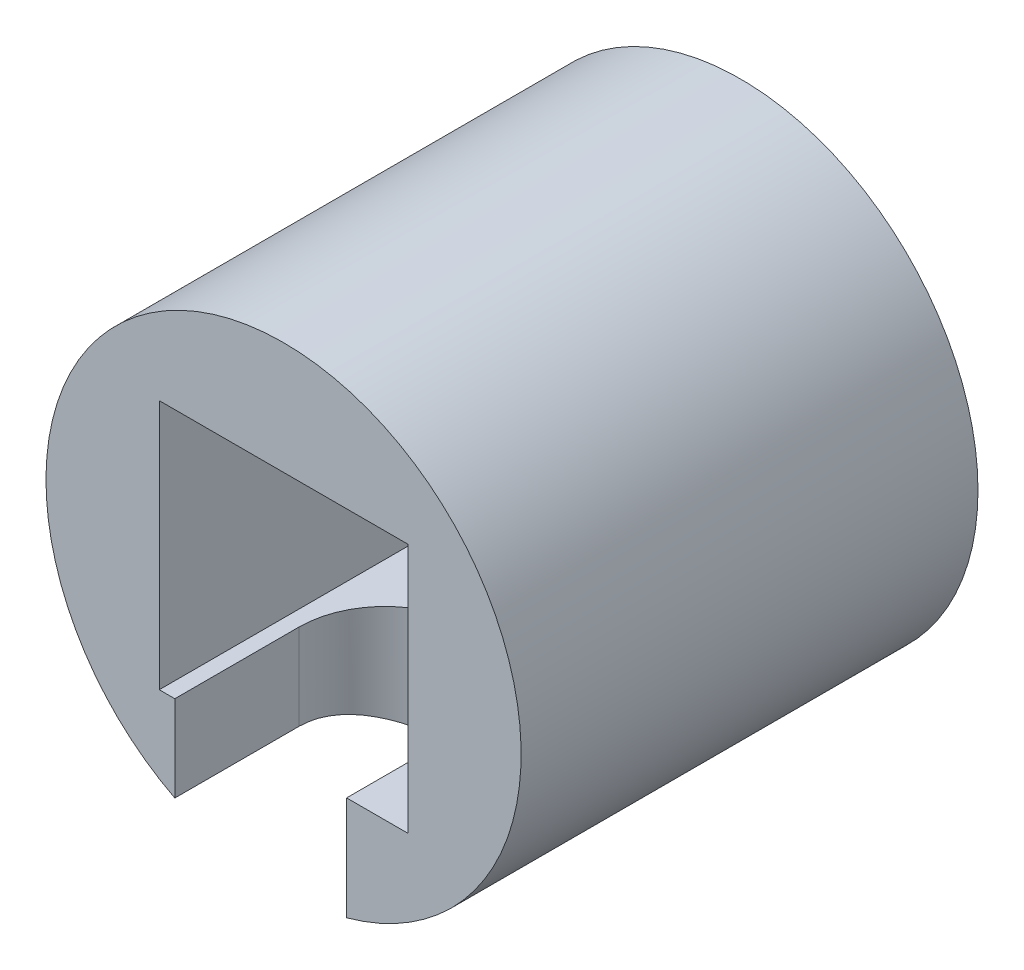
from build123d import *

# Parameters (mm, degrees)
SKETCH1_R               = 13
SKETCH1_R_2             = 3
BOSS_EXTRUDE1_DEPTH     = 25
SKETCH2_W               = 13.6
SKETCH2_H               = 13.7
CUT_EXTRUDE1_DEPTH      = 6.85
CUT_EXTRUDE2_REACH      = 33.032
CUT_EXTRUDE2_END_RADIUS = 13


with BuildPart() as part:
    # Sketch1 → Boss-Extrude1 (new body)
    with BuildSketch(Plane.XY):
        Circle(SKETCH1_R)
        Circle(SKETCH1_R_2, mode=Mode.SUBTRACT)
    extrude(amount=BOSS_EXTRUDE1_DEPTH)

    # Sketch2 → Cut-Extrude1 (cut, symmetric)
    with BuildSketch(Plane(origin=(0, 0, 0), x_dir=(1, 0, 0), z_dir=(0, 1, 0))):
        with Locations((0, -18.15)):
            Rectangle(SKETCH2_W, SKETCH2_H)
    extrude(amount=CUT_EXTRUDE1_DEPTH, both=True, mode=Mode.SUBTRACT)

    # Cut-Extrude2: up to this cylinder (the profile starts inside it)
    cut_extrude2_end = Plane(origin=(0, 0, 19.701869), z_dir=(0, 0, -1)) * Cylinder(CUT_EXTRUDE2_END_RADIUS, 93.064, mode=Mode.PRIVATE)
    # Sketch3 → Cut-Extrude2 (cut, up to the surface)
    with BuildSketch(Plane(origin=(0, 0, 0), x_dir=(1, 0, 0), z_dir=(0, 1, 0)), mode=Mode.PRIVATE) as cut_extrude2_sk1:
        with BuildLine():
            Line((-5.95, -18.2), (-5.95, -25))
            Line((-5.95, -25), (3.45, -25))
            Line((3.45, -25), (3.45, -18.2))
            ThreePointArc((3.45, -18.2), (-1.25, -13.5), (-5.95, -18.2))
        make_face()
    cut_extrude2_tool1 = extrude(cut_extrude2_sk1.sketch, amount=-CUT_EXTRUDE2_REACH, mode=Mode.PRIVATE) & cut_extrude2_end
    add(cut_extrude2_tool1.solids().sort_by_distance((-1.25, 0, 19.701869))[0], mode=Mode.SUBTRACT)


solid = part.part
